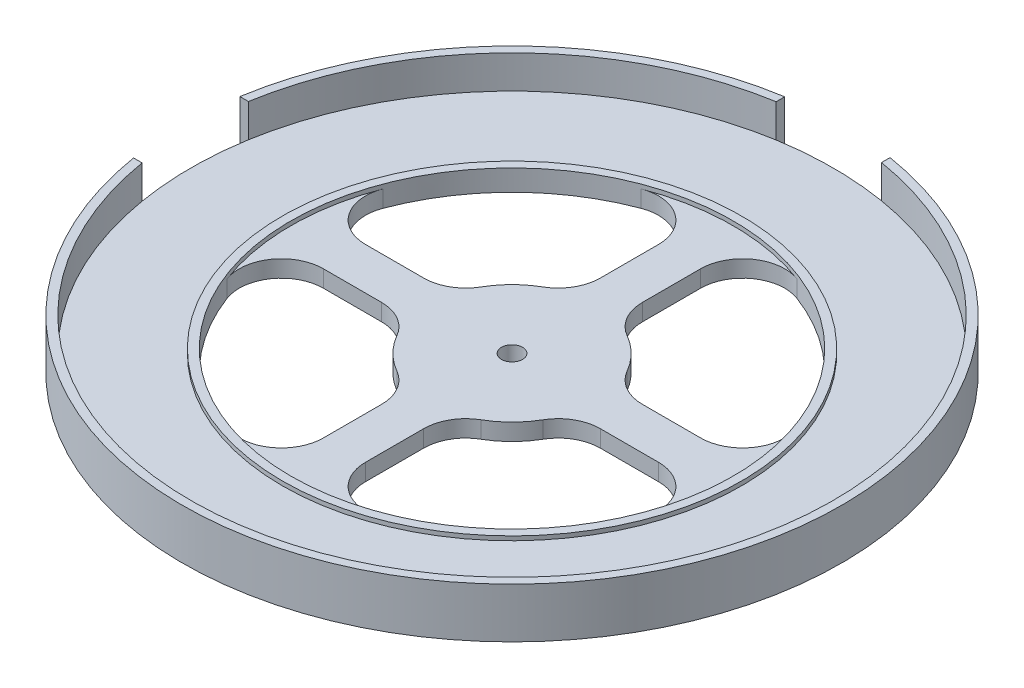
from build123d import *

# Parameters (mm, degrees)
SKETCH1_R             = 5
BOSS_EXTRUDE3_DEPTH   = 8
SKETCH1_R_2           = 152.5
SKETCH1_R_3           = 109
BOSS_EXTRUDE3_2_DEPTH = 8
BOSS_EXTRUDE4_DEPTH   = 23.75
SKETCH1_9_R           = 109
SKETCH1_9_R_2         = 105
BOSS_EXTRUDE5_DEPTH   = 10
BOSS_EXTRUDE6_DEPTH   = 23.75
BOSS_EXTRUDE7_START   = -8
SKETCH2_R             = 40
SKETCH2_R_2           = 5
BOSS_EXTRUDE7_DEPTH   = 8
FILLET1_R             = 20


with BuildPart() as part:
    # Sketch1 → Boss-Extrude3 (new body)
    with BuildSketch(Plane(origin=(0, 0, 0), x_dir=(1, 0, 0), z_dir=(0, 1, 0))):
        with BuildLine():
            ThreePointArc((10, 104.522724802), (0, 105), (-10, 104.522724802))
            Line((-10, 104.522724802), (-10, 10))
            Line((-10, 10), (-104.522724802, 10))
            ThreePointArc((-104.522724802, 10), (-105, 0), (-104.522724802, -10))
            Line((-104.522724802, -10), (-10, -10))
            Line((-10, -10), (-10, -104.522724802))
            ThreePointArc((-10, -104.522724802), (0, -105), (10, -104.522724802))
            Line((10, -104.522724802), (10, -10))
            Line((10, -10), (104.522724802, -10))
            ThreePointArc((104.522724802, -10), (105, 0), (104.522724802, 10))
            Line((104.522724802, 10), (10, 10))
            Line((10, 10), (10, 104.522724802))
        make_face()
        with Locations(Location((0, 0, 0), (0, 0, 270))):
            Circle(SKETCH1_R, mode=Mode.SUBTRACT)
    extrude(amount=BOSS_EXTRUDE3_DEPTH)



with BuildPart() as body_2:
    # Sketch1 → Boss-Extrude3 2 (new body)
    with BuildSketch(Plane(origin=(0, 0, 0), x_dir=(1, 0, 0), z_dir=(0, 1, 0))):
        with Locations(Location((0, 0, 0), (0, 0, 270))):
            Circle(SKETCH1_R_2)
        with Locations(Location((0, 0, 0), (0, 0, 270))):
            Circle(SKETCH1_R_3, mode=Mode.SUBTRACT)
    extrude(amount=BOSS_EXTRUDE3_2_DEPTH)

    # Sketch1<8> → Boss-Extrude4 (add)
    with BuildSketch(Plane(origin=(0, 0, 0), x_dir=(1, 0, 0), z_dir=(0, 1, 0))):
        with BuildLine():
            Line((25, 154.490290957), (25, 150.436863833))
            ThreePointArc((25, 150.436863833), (116.337332787, 98.599568965), (152.5, 0))
            ThreePointArc((152.5, 0), (12.667954727, -151.972934837), (-150.395382597, -25.248344371))
            Line((-150.395382597, -25.248344371), (-154.44989837, -25.248344371))
            ThreePointArc((-154.44989837, -25.248344371), (110.751132294, -110.573218709), (25, 154.490290957))
        make_face()
    extrude(amount=BOSS_EXTRUDE4_DEPTH)


with BuildPart() as part_1:
    add(part.part)

    add(body_2.part)  # Boss-Extrude5 merges body 2
    # Sketch1<9> → Boss-Extrude5 (add)
    with BuildSketch(Plane(origin=(0, 0, 0), x_dir=(1, 0, 0), z_dir=(0, 1, 0))):
        with Locations(Location((0, 0, 0), (0, 0, 270))):
            Circle(SKETCH1_9_R)
        with Locations(Location((0, 0, 0), (0, 0, 84.5349762))):
            Circle(SKETCH1_9_R_2, mode=Mode.SUBTRACT)
    extrude(amount=BOSS_EXTRUDE5_DEPTH)

    # Sketch1<10> → Boss-Extrude6 (add)
    with BuildSketch(Plane(origin=(0, 0, 0), x_dir=(1, 0, 0), z_dir=(0, 1, 0))):
        with BuildLine():
            ThreePointArc((-150.395382597, 25.248344371), (-107.744727994, 107.922766781), (-25, 150.436863833))
            Line((-25, 150.436863833), (-25, 154.490290957))
            ThreePointArc((-25, 154.490290957), (-110.573218709, 110.751132294), (-154.44989837, 25.248344371))
            Line((-154.44989837, 25.248344371), (-150.395382597, 25.248344371))
        make_face()
    extrude(amount=BOSS_EXTRUDE6_DEPTH)

    # Sketch2 → Boss-Extrude7 (add)
    with BuildSketch(Plane(origin=(0, 8, 0), x_dir=(1, 0, 0), z_dir=(0, 1, 0)).offset(BOSS_EXTRUDE7_START)):
        Circle(SKETCH2_R)
        with Locations(Location((0, 0, 0), (0, 0, 270))):
            Circle(SKETCH2_R_2, mode=Mode.SUBTRACT)
    extrude(amount=BOSS_EXTRUDE7_DEPTH)

    # Fillet1
    # the kernel refuses this fillet: 20 mm, written as the material it adds along each edge
    with BuildSketch(Plane(origin=(-38.729833462, 8, 10), x_dir=(-1, 0, 0), z_dir=(0, -1, 0)), Plane(origin=(10, 8, 38.729833462), x_dir=(0, 0, 1), z_dir=(0, -1, 0)), Plane(origin=(-10, 8, -38.729833462), x_dir=(0, 0, -1), z_dir=(0, -1, 0)), Plane(origin=(38.729833462, 8, -10), x_dir=(1, 0, 0), z_dir=(0, -1, 0))) as fillet1_piece_1:
        with BuildLine():
            CenterArc((13.231690765, -20), FILLET1_R, 90, 60)
            ThreePointArc((-4.088817311, -10), (-1.705241726, -5.138679161), (0, 0))
            Line((0, 0), (13.231690765, 0))
        make_face()
    extrude(amount=8)
    with BuildSketch(Plane(origin=(-38.729833462, 8, -10), x_dir=(-1, 0, 0), z_dir=(0, -1, 0)), Plane(origin=(-10, 8, 38.729833462), x_dir=(0, 0, 1), z_dir=(0, -1, 0)), Plane(origin=(38.729833462, 8, 10), x_dir=(1, 0, 0), z_dir=(0, -1, 0)), Plane(origin=(10, 8, -38.729833462), x_dir=(0, 0, -1), z_dir=(0, -1, 0))) as fillet1_piece_2:
        with BuildLine():
            CenterArc((13.231690765, 20), FILLET1_R, 210, 60)
            ThreePointArc((-4.088817311, 10), (-1.705241726, 5.138679161), (0, 0))
            Line((0, 0), (13.231690765, 0))
        make_face()
    extrude(amount=8)
    with BuildSketch(Plane(origin=(-10, 0, -104.522724802), x_dir=(-0.974109622021504, 0, 0.22607619132744317), z_dir=(0, 1, 0)), Plane(origin=(104.522724802, 0, -10), x_dir=(-0.22607619132744408, 0, -0.9741096220215036), z_dir=(0, 1, 0)), Plane(origin=(10, 0, 104.522724802), x_dir=(0.9741096220215038, 0, -0.2260761913274436), z_dir=(0, 1, 0)), Plane(origin=(-104.522724802, 0, 10), x_dir=(0.22607619132744342, 0, 0.974109622021504), z_dir=(0, 1, 0))) as fillet1_piece_3:
        with BuildLine():
            CenterArc((25.13248218, 19.824257879), FILLET1_R, 166.933829853, 110.667316494)
            Line((5.65028974, 24.345781705), (0, 0))
            ThreePointArc((0, 0), (13.88900331, -0.922646137), (27.77800662, 0))
        make_face()
    extrude(amount=8)
    with BuildSketch(Plane(origin=(10, 0, -104.522724802), x_dir=(0.974109622021504, 0, 0.2260761913274437), z_dir=(0, 1, 0)), Plane(origin=(104.522724802, 0, 10), x_dir=(-0.22607619132744344, 0, 0.9741096220215039), z_dir=(0, 1, 0)), Plane(origin=(-10, 0, 104.522724802), x_dir=(-0.9741096220215041, 0, -0.22607619132744258), z_dir=(0, 1, 0)), Plane(origin=(-104.522724802, 0, -10), x_dir=(0.22607619132744275, 0, -0.9741096220215041), z_dir=(0, 1, 0))) as fillet1_piece_4:
        with BuildLine():
            CenterArc((25.13248218, -19.824257879), FILLET1_R, 82.398853653, 110.667316494)
            Line((5.65028974, -24.345781705), (0, 0))
            ThreePointArc((0, 0), (13.88900331, 0.922646137), (27.77800662, 0))
        make_face()
    extrude(amount=8)


solid = part_1.part
